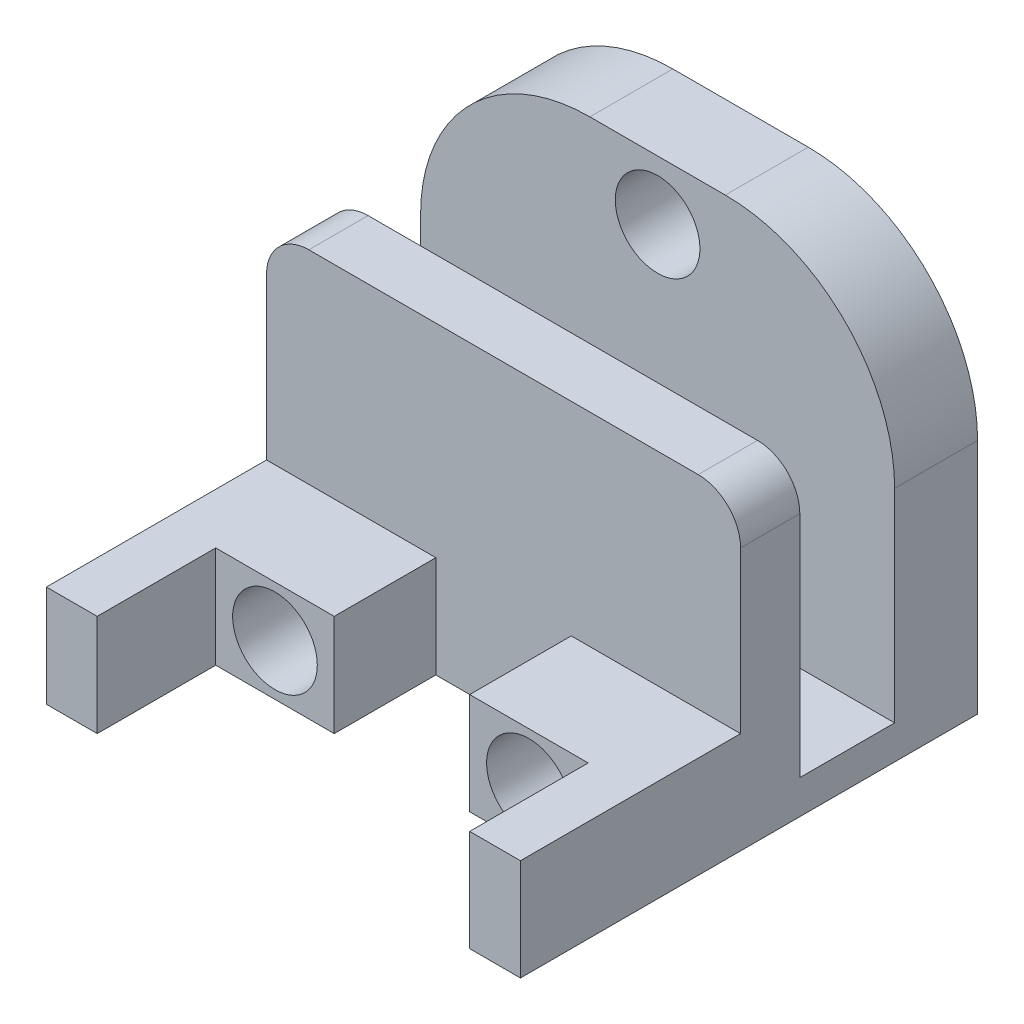
from build123d import *

# Parameters (mm, degrees)
BOSS_EXTRUDE1_DEPTH = 7.62
SKETCH2_W           = 35.56
SKETCH2_H           = 17.78
BOSS_EXTRUDE2_DEPTH = 22.86
SKETCH4_W           = 35.56
SKETCH4_H           = 7.112
CUT_EXTRUDE2_DEPTH  = 27.94
SKETCH5_W           = 35.56
SKETCH5_H           = 4.445
CUT_EXTRUDE3_DEPTH  = 7.62
SKETCH6_R           = 3.175
CUT_EXTRUDE4_DEPTH  = 6.35
SKETCH7_R           = 3.175
CUT_EXTRUDE5_DEPTH  = 9.525
FILLET1_R           = 12.7
FILLET2_R           = 3.175


with BuildPart() as part:
    # Sketch1 → Boss-Extrude1 (new body)
    with BuildSketch(Plane(origin=(0, 0, 0), x_dir=(1, 0, 0), z_dir=(0, 1, 0))):
        Polygon((0, 25.4), (0, 0), (0, -8.89), (3.81, -8.89), (3.81, 0), (12.7, 0), (12.7, 7.62), (22.86, 7.62), (22.86, 0), (31.75, 0), (31.75, -8.89), (35.56, -8.89), (35.56, 0), (35.56, 25.4), align=None)
    extrude(amount=BOSS_EXTRUDE1_DEPTH)

    # Sketch2 → Boss-Extrude2 (add)
    with BuildSketch(Plane(origin=(0, 7.62, 0), x_dir=(1, 0, 0), z_dir=(0, 1, 0))):
        with Locations((17.78, 16.51)):
            Rectangle(SKETCH2_W, SKETCH2_H)
    extrude(amount=BOSS_EXTRUDE2_DEPTH)

    # Sketch4 → Cut-Extrude2 (cut)
    with BuildSketch(Plane(origin=(0, 30.48, 0), x_dir=(1, 0, 0), z_dir=(0, 1, 0))):
        with Locations((17.78, 15.621)):
            Rectangle(SKETCH4_W, SKETCH4_H)
    extrude(amount=-CUT_EXTRUDE2_DEPTH, mode=Mode.SUBTRACT)

    # Sketch5 → Cut-Extrude3 (cut)
    with BuildSketch(Plane(origin=(0, 30.48, 0), x_dir=(1, 0, 0), z_dir=(0, 1, 0))):
        with Locations((17.78, 9.8425)):
            Rectangle(SKETCH5_W, SKETCH5_H)
    extrude(amount=-CUT_EXTRUDE3_DEPTH, mode=Mode.SUBTRACT)

    # Sketch6 → Cut-Extrude4 (cut)
    with BuildSketch(Plane(origin=(0, 0, -25.4), x_dir=(-1, 0, 0), z_dir=(0, 0, -1))):
        with Locations((-17.78, 26.035)):
            Circle(SKETCH6_R)
    extrude(amount=-CUT_EXTRUDE4_DEPTH, mode=Mode.SUBTRACT)

    # Sketch7 → Cut-Extrude5 (cut)
    with BuildSketch(Plane.XY):
        with Locations((27.305, 3.81)):
            Circle(SKETCH7_R)
        with Locations((8.255, 3.81)):
            Circle(SKETCH7_R)
    extrude(amount=-CUT_EXTRUDE5_DEPTH, mode=Mode.SUBTRACT)

    # Fillet1
    fillet1_edges = [part.edges().sort_by_distance(p)[0] for p in [
        (0, 30.48, -22.2885),
        (35.56, 30.48, -22.2885),
    ]]
    fillet(fillet1_edges, radius=FILLET1_R)

    # Fillet2
    fillet2_edges = [part.edges().sort_by_distance(p)[0] for p in [
        (0, 22.86, -9.8425),
        (35.56, 22.86, -9.8425),
    ]]
    fillet(fillet2_edges, radius=FILLET2_R)


solid = part.part
